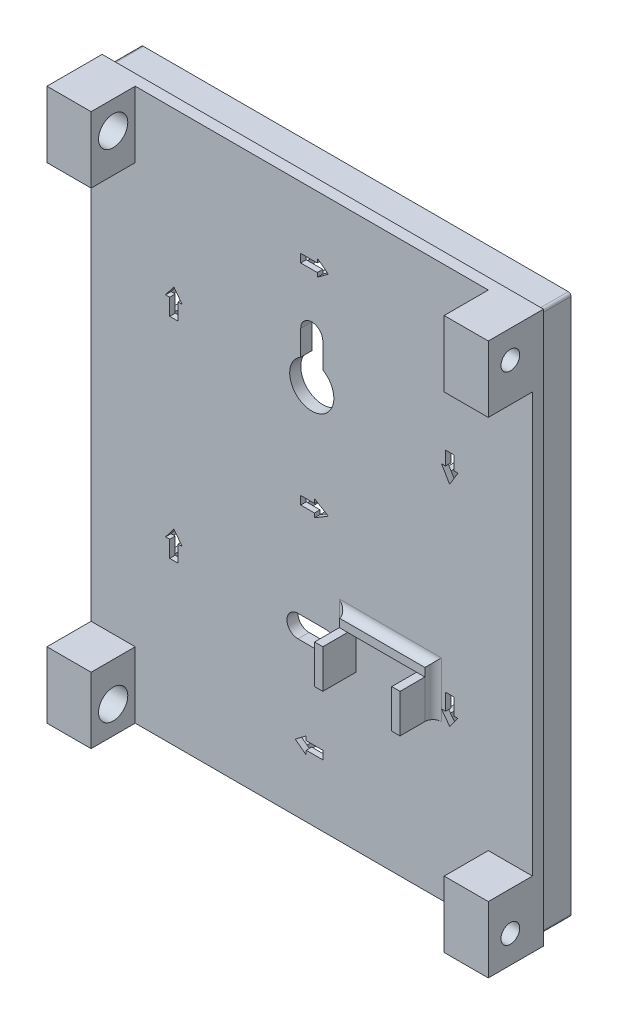
from build123d import *

# Parameters (mm, degrees)
SKETCH1_W               = 80
SKETCH1_H               = 100
SKETCH1_W_2             = 31
SKETCH1_H_2             = 11
SKETCH1_W_3             = 11
SKETCH1_H_3             = 31
BOSS_EXTRUDE1_DEPTH     = 1
SKETCH2_W               = 80
SKETCH2_H               = 100
BACK_DEPTH              = 1
SKETCH3_W               = 13
SKETCH3_H               = 33
SKETCH3_W_2             = 11
SKETCH3_H_2             = 31
SKETCH3_W_3             = 33
SKETCH3_H_3             = 13
SKETCH3_W_4             = 31
SKETCH3_H_4             = 11
SEG_MASKS_DEPTH         = 6
SKETCH5_W               = 78
SKETCH5_H               = 98
SKETCH5_W_2             = 76
SKETCH5_H_2             = 96
OUTER_RIM_DEPTH         = 6
DIRECTION_DEPTH         = 65.412731661
DIRECTION_DEPTH_BACK    = 65.412731661
SKETCH7_W               = 17
SKETCH7_H               = 7
SKETCH7_W_2             = 7
SKETCH7_H_2             = 11.013011135
SKETCH7_H_3             = 10.96937703
SKETCH7_H_4             = 11.03062297
WIRE_CHASES_DEPTH       = 6
HANGING_HOLE_DEPTH      = 65.311740763
HANGING_HOLE_DEPTH_BACK = 65.311740763
FILLET1_R               = 0.5
SKETCH9_W               = 8
SKETCH9_H               = 12
BOSS_EXTRUDE2_DEPTH     = 8
CUT_EXTRUDE1_DEPTH      = 95.868329805
CUT_EXTRUDE1_DEPTH_BACK = 95.868329805
SKETCH10_R              = 1.7
SKETCH11_R              = 2.65
CUT_EXTRUDE2_DEPTH      = 3.9
MIRROR4_COPY_1_SKETCH_R = 2.65
MIRROR4_COPY_1_DEPTH    = 3.9
MIRROR4_COPY_2_SKETCH_R = 2.65
MIRROR4_COPY_2_DEPTH    = 3.9
SKETCH12_W              = 1.5
SKETCH12_H              = 7
BOSS_EXTRUDE3_DEPTH     = 6
SKETCH13_W              = 15.5
SKETCH13_H              = 1.5
BOSS_EXTRUDE4_DEPTH     = 1.5
FILLET2_R               = 1.5
CUT_EXTRUDE3_DEPTH      = 65.807406984
CUT_EXTRUDE3_DEPTH_BACK = 65.807406984


with BuildPart() as part:
    # Sketch1 → Boss-Extrude1 (new body)
    with BuildSketch(Plane.XY):
        Rectangle(SKETCH1_W, SKETCH1_H)
        with Locations((0, 38)):
            Rectangle(SKETCH1_W_2, SKETCH1_H_2, mode=Mode.SUBTRACT)
        Rectangle(SKETCH1_W_2, SKETCH1_H_2, mode=Mode.SUBTRACT)
        with Locations((0, -38)):
            Rectangle(SKETCH1_W_2, SKETCH1_H_2, mode=Mode.SUBTRACT)
        with Locations((25, 19)):
            Rectangle(SKETCH1_W_3, SKETCH1_H_3, mode=Mode.SUBTRACT)
        with Locations((-25, 19)):
            Rectangle(SKETCH1_W_3, SKETCH1_H_3, mode=Mode.SUBTRACT)
        with Locations((-25, -19)):
            Rectangle(SKETCH1_W_3, SKETCH1_H_3, mode=Mode.SUBTRACT)
        with Locations((25, -19)):
            Rectangle(SKETCH1_W_3, SKETCH1_H_3, mode=Mode.SUBTRACT)
    extrude(amount=BOSS_EXTRUDE1_DEPTH)

    # Sketch2 → back (add)
    with BuildSketch(Plane.XY.offset(1)):
        Rectangle(SKETCH2_W, SKETCH2_H)
    extrude(amount=BACK_DEPTH)

    # Sketch3 → seg masks (add)
    # profile 1 of 7: a face of its own
    with BuildSketch(Plane(origin=(0, 0, 0), x_dir=(-1, 0, 0), z_dir=(0, 0, -1))):
        with Locations((-25, 19)):
            Rectangle(SKETCH3_W, SKETCH3_H)
        with Locations((-25, 19)):
            Rectangle(SKETCH3_W_2, SKETCH3_H_2, mode=Mode.SUBTRACT)
    # profile 2 of 7: a face of its own
    with BuildSketch(Plane(origin=(0, 0, 0), x_dir=(-1, 0, 0), z_dir=(0, 0, -1))):
        with Locations((0, 38)):
            Rectangle(SKETCH3_W_3, SKETCH3_H_3)
        with Locations((0, 38)):
            Rectangle(SKETCH3_W_4, SKETCH3_H_4, mode=Mode.SUBTRACT)
    # profile 3 of 7: a face of its own
    with BuildSketch(Plane(origin=(0, 0, 0), x_dir=(-1, 0, 0), z_dir=(0, 0, -1))):
        with Locations((25, 19)):
            Rectangle(SKETCH3_W, SKETCH3_H)
        with Locations((25, 19)):
            Rectangle(SKETCH3_W_2, SKETCH3_H_2, mode=Mode.SUBTRACT)
    # profile 4 of 7: a face of its own
    with BuildSketch(Plane(origin=(0, 0, 0), x_dir=(-1, 0, 0), z_dir=(0, 0, -1))):
        Rectangle(SKETCH3_W_3, SKETCH3_H_3)
        Rectangle(SKETCH3_W_4, SKETCH3_H_4, mode=Mode.SUBTRACT)
    # profile 5 of 7: a face of its own
    with BuildSketch(Plane(origin=(0, 0, 0), x_dir=(-1, 0, 0), z_dir=(0, 0, -1))):
        with Locations((-25, -19)):
            Rectangle(SKETCH3_W, SKETCH3_H)
        with Locations((-25, -19)):
            Rectangle(SKETCH3_W_2, SKETCH3_H_2, mode=Mode.SUBTRACT)
    # profile 6 of 7: a face of its own
    with BuildSketch(Plane(origin=(0, 0, 0), x_dir=(-1, 0, 0), z_dir=(0, 0, -1))):
        with Locations((0, -38)):
            Rectangle(SKETCH3_W_3, SKETCH3_H_3)
        with Locations((0, -38)):
            Rectangle(SKETCH3_W_4, SKETCH3_H_4, mode=Mode.SUBTRACT)
    # profile 7 of 7: a face of its own
    with BuildSketch(Plane(origin=(0, 0, 0), x_dir=(-1, 0, 0), z_dir=(0, 0, -1))):
        with Locations((25, -19)):
            Rectangle(SKETCH3_W, SKETCH3_H)
        with Locations((25, -19)):
            Rectangle(SKETCH3_W_2, SKETCH3_H_2, mode=Mode.SUBTRACT)
    extrude(amount=SEG_MASKS_DEPTH)

    # Sketch5 → outer rim (add)
    with BuildSketch(Plane(origin=(0, 0, 0), x_dir=(-1, 0, 0), z_dir=(0, 0, -1))):
        Rectangle(SKETCH5_W, SKETCH5_H)
        Rectangle(SKETCH5_W_2, SKETCH5_H_2, mode=Mode.SUBTRACT)
    extrude(amount=OUTER_RIM_DEPTH)

    # Sketch6 → direction (cut, two sides: drawn at the far end of the back side and taken through both)
    with BuildSketch(Plane(origin=(0, 0, 1), x_dir=(-1, 0, 0), z_dir=(0, 0, -1)).offset(-DIRECTION_DEPTH_BACK)):
        Polygon((25, 22), (23.5, 20), (24.25, 20), (24.25, 17), (25.75, 17), (25.75, 20), (26.5, 20), align=None)
        Polygon((-3, 38), (-1, 36.5), (-1, 37.25), (2, 37.25), (2, 38.75), (-1, 38.75), (-1, 39.5), align=None)
        Polygon((-24.25, 21), (-25.75, 21), (-25.75, 18.5), (-26.5, 18.5), (-25, 16), (-23.5, 18.5), (-24.25, 18.5), align=None)
        Polygon((-24.25, -17), (-25.75, -17), (-25.75, -20), (-26.5, -20), (-25, -22), (-23.5, -20), (-24.25, -20), align=None)
        Polygon((-2, -38.75), (-2, -37.25), (1, -37.25), (1, -36.5), (3, -38), (1, -39.5), (1, -38.75), align=None)
        Polygon((25, -16), (23.5, -18), (24.25, -18), (24.25, -21), (25.75, -21), (25.75, -18), (26.5, -18), align=None)
        Polygon((-0.5, 1.5), (-3, 0), (-0.5, -1.5), (-0.5, -0.75), (2, -0.75), (2, 0), (2, 0.75), (-0.5, 0.75), align=None)
    extrude(amount=DIRECTION_DEPTH + DIRECTION_DEPTH_BACK, mode=Mode.SUBTRACT)

    # Sketch7 → wire chases (cut)
    with BuildSketch(Plane(origin=(0, 0, -6), x_dir=(-1, 0, 0), z_dir=(0, 0, -1))):
        Polygon((-6.5, 46), (-3.5, 46), (-3.5, 39.513011135), (3.5, 39.513011135), (3.5, 46), (6.5, 46), (6.5, 39.513011135), (18, 39.513011135), (18, 36.513011135), (6.5, 36.513011135), (6.5, 25.5), (23.5, 25.5), (23.5, 37.5), (26.5, 37.5), (26.5, 25.5), (33, 25.5), (33, 22.5), (26.5, 22.5), (26.5, 15.5), (33, 15.5), (33, 12.5), (26.5, 12.5), (26.5, -12.5), (33, -12.5), (33, -15.5), (26.5, -15.5), (26.5, -22.5), (33, -22.5), (33, -25.5), (26.5, -25.5), (26.5, -37.5), (23.5, -37.5), (23.5, -25.5), (6.5, -25.5), (6.5, -36.513011135), (18, -36.513011135), (18, -39.513011135), (6.5, -39.513011135), (6.5, -46), (3.5, -46), (3.5, -39.513011135), (-3.5, -39.513011135), (-3.5, -46), (-6.5, -46), (-6.5, -39.513011135), (-18, -39.513011135), (-18, -36.513011135), (-6.5, -36.513011135), (-6.5, -25.5), (-23.5, -25.5), (-23.5, -37.5), (-26.5, -37.5), (-26.5, -25.5), (-33, -25.5), (-33, -22.5), (-26.5, -22.5), (-26.5, -15.5), (-33, -15.5), (-33, -12.5), (-26.5, -12.5), (-26.5, 12.5), (-33, 12.5), (-33, 15.5), (-26.5, 15.5), (-26.5, 22.5), (-33, 22.5), (-33, 25.5), (-26.5, 25.5), (-26.5, 37.5), (-23.5, 37.5), (-23.5, 25.5), (-6.5, 25.5), (-6.5, 36.513011135), (-18, 36.513011135), (-18, 39.513011135), (-6.5, 39.513011135), align=None)
        with Locations((-15, 19)):
            Rectangle(SKETCH7_W, SKETCH7_H, mode=Mode.SUBTRACT)
        with Locations((0, 31.006505567)):
            Rectangle(SKETCH7_W_2, SKETCH7_H_2, mode=Mode.SUBTRACT)
        with Locations((0, 19)):
            Rectangle(SKETCH7_W_2, SKETCH7_H, mode=Mode.SUBTRACT)
        with Locations((15, 19)):
            Rectangle(SKETCH7_W, SKETCH7_H, mode=Mode.SUBTRACT)
        Polygon((-6.5, 12.5), (-6.5, 1.53062297), (-18, 1.53062297), (-18, -1.46937703), (-6.5, -1.46937703), (-6.5, -12.5), (-23.5, -12.5), (-23.5, 12.5), align=None, mode=Mode.SUBTRACT)
        with Locations((0, 7.015311485)):
            Rectangle(SKETCH7_W_2, SKETCH7_H_3, mode=Mode.SUBTRACT)
        Polygon((6.5, 12.5), (23.5, 12.5), (23.5, -12.5), (6.5, -12.5), (6.5, -1.46937703), (18, -1.46937703), (18, 1.53062297), (6.5, 1.53062297), align=None, mode=Mode.SUBTRACT)
        with Locations((-15, -19)):
            Rectangle(SKETCH7_W, SKETCH7_H, mode=Mode.SUBTRACT)
        with Locations((0, -6.984688515)):
            Rectangle(SKETCH7_W_2, SKETCH7_H_4, mode=Mode.SUBTRACT)
        with Locations((0, -19)):
            Rectangle(SKETCH7_W_2, SKETCH7_H, mode=Mode.SUBTRACT)
        with Locations((15, -19)):
            Rectangle(SKETCH7_W, SKETCH7_H, mode=Mode.SUBTRACT)
        with Locations((0, -31.006505567)):
            Rectangle(SKETCH7_W_2, SKETCH7_H_2, mode=Mode.SUBTRACT)
    extrude(amount=-WIRE_CHASES_DEPTH, mode=Mode.SUBTRACT)

    # Sketch8 → hanging hole (cut, two sides: drawn at the far end of the back side and taken through both)
    with BuildSketch(Plane(origin=(0, 0, 0), x_dir=(-1, 0, 0), z_dir=(0, 0, -1)).offset(-HANGING_HOLE_DEPTH_BACK)):
        with BuildLine():
            Line((2, 27), (2, 22.464101615))
            ThreePointArc((2, 22.464101615), (0, 15), (-2, 22.464101615))
            Line((-2, 22.464101615), (-2, 27))
            ThreePointArc((-2, 27), (0, 29), (2, 27))
        make_face()
    extrude(amount=HANGING_HOLE_DEPTH + HANGING_HOLE_DEPTH_BACK, mode=Mode.SUBTRACT)

    # Fillet1
    fillet1_edges = [part.edges().sort_by_distance(p)[0] for p in [
        (-39, -49, -3),
        (-39, 49, -3),
        (39, 49, -3),
        (39, -49, -3),
        (38, -48, -3),
        (-38, -48, -3),
        (-38, 48, -3),
        (38, 48, -3),
    ]]
    fillet(fillet1_edges, radius=FILLET1_R)

    # Sketch9 → Boss-Extrude2 (add)
    with BuildSketch(Plane.XY.offset(2)):
        with Locations((-36, 44)):
            Rectangle(SKETCH9_W, SKETCH9_H)
        with Locations((-36, -44)):
            Rectangle(SKETCH9_W, SKETCH9_H)
        with Locations((36, -44)):
            Rectangle(SKETCH9_W, SKETCH9_H)
        with Locations((36, 44)):
            Rectangle(SKETCH9_W, SKETCH9_H)
    extrude(amount=BOSS_EXTRUDE2_DEPTH)

    # Sketch10 → Cut-Extrude1 (cut, two sides: drawn at the far end of the back side and taken through both)
    with BuildSketch(Plane(origin=(40, 0, 0), x_dir=(0, 0, -1), z_dir=(1, 0, 0)).offset(-CUT_EXTRUDE1_DEPTH_BACK)):
        with Locations((-6, 45)):
            Circle(SKETCH10_R)
        with Locations((-6, -45)):
            Circle(SKETCH10_R)
    extrude(amount=CUT_EXTRUDE1_DEPTH + CUT_EXTRUDE1_DEPTH_BACK, mode=Mode.SUBTRACT)

    # Sketch11 → Cut-Extrude2 (cut)
    with BuildSketch(Plane(origin=(-32, 0, 0), x_dir=(0, 0, -1), z_dir=(1, 0, 0))):
        with Locations((-6, 45)):
            Circle(SKETCH11_R)
    cut_extrude2 = extrude(amount=-CUT_EXTRUDE2_DEPTH, mode=Mode.SUBTRACT)

    # Mirror1: Cut-Extrude2 across plane
    add(cut_extrude2.mirror(Plane.ZX), mode=Mode.SUBTRACT)

    # Mirror2: Cut-Extrude2 across plane
    add(cut_extrude2.mirror(Plane(origin=(0, 0, 0), x_dir=(0, 0, 1), z_dir=(1, 0, 0))), mode=Mode.SUBTRACT)

    # Mirror4 copy 1 sketch → Mirror4 copy 1 (cut)
    with BuildSketch(Plane(origin=(32, 0, 0), x_dir=(0, 0, -1), z_dir=(-1, 0, 0))):
        with Locations((-6, 45)):
            Circle(MIRROR4_COPY_1_SKETCH_R)
    extrude(amount=-MIRROR4_COPY_1_DEPTH, mode=Mode.SUBTRACT)

    # Mirror4 copy 2 sketch → Mirror4 copy 2 (cut)
    with BuildSketch(Plane(origin=(32, 0, 0), x_dir=(0, 0, -1), z_dir=(-1, 0, 0))):
        with Locations((-6, -45)):
            Circle(MIRROR4_COPY_2_SKETCH_R)
    extrude(amount=-MIRROR4_COPY_2_DEPTH, mode=Mode.SUBTRACT)

    # Sketch12 → Boss-Extrude3 (add)
    with BuildSketch(Plane.XY.offset(2)):
        with Locations((7.25, -18.5)):
            Rectangle(SKETCH12_W, SKETCH12_H)
        with Locations((21.25, -18.5)):
            Rectangle(SKETCH12_W, SKETCH12_H)
    extrude(amount=BOSS_EXTRUDE3_DEPTH)

    # Sketch13 → Boss-Extrude4 (add)
    with BuildSketch(Plane.XY.offset(2)):
        with Locations((14.25, -14.25)):
            Rectangle(SKETCH13_W, SKETCH13_H)
    extrude(amount=BOSS_EXTRUDE4_DEPTH)

    # Fillet2
    fillet2_edges = [part.edges().sort_by_distance(p)[0] for p in [
        (22, -17.75, 2),
        (14.25, -13.5, 2),
        (6.5, -17.75, 2),
    ]]
    fillet(fillet2_edges, radius=FILLET2_R - 0.0001)  # a hair under: the kernel refuses the full size

    # Sketch14 → Cut-Extrude3 (cut, two sides: drawn at the far end of the back side and taken through both)
    with BuildSketch(Plane(origin=(0, 0, 0), x_dir=(-1, 0, 0), z_dir=(0, 0, -1)).offset(-CUT_EXTRUDE3_DEPTH_BACK)):
        with BuildLine():
            Line((-2.5, -18), (2.5, -18))
            ThreePointArc((2.5, -18), (4.5, -20), (2.5, -22))
            Line((2.5, -22), (-2.5, -22))
            ThreePointArc((-2.5, -22), (-4.5, -20), (-2.5, -18))
        make_face()
    extrude(amount=CUT_EXTRUDE3_DEPTH + CUT_EXTRUDE3_DEPTH_BACK, mode=Mode.SUBTRACT)


solid = part.part
